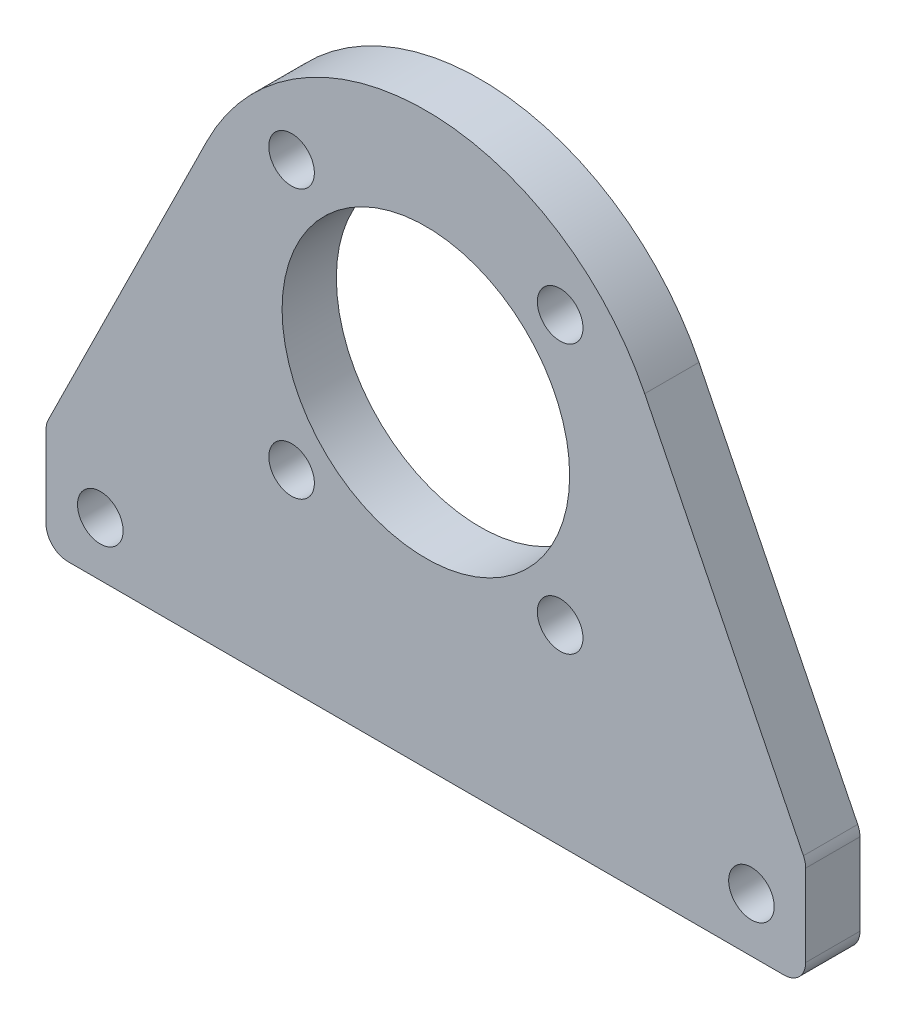
from build123d import *

# Parameters (mm, degrees)
SKETCH_1_R      = 2.1
SKETCH_1_R_2    = 13.25
EXTRUDE_1_DEPTH = 5
FILLET_1_R      = 2


with BuildPart() as part:
    # ｽｹｯﾁ1 → ﾎﾞｽ - 押し出し1 (new body)
    with BuildSketch(Plane.XY):
        with BuildLine():
            Line((-35, -110), (-20.166291803, -80.021489344))
            ThreePointArc((-20.166291803, -80.021489344), (0, -67.5), (20.166291803, -80.021489344))
            Line((20.166291803, -80.021489344), (35, -110))
            Line((35, -110), (35, -120))
            Line((35, -120), (-35, -120))
            Line((-35, -120), (-35, -110))
        make_face()
        with Locations((12.374368671, -77.625631329)):
            Circle(SKETCH_1_R, mode=Mode.SUBTRACT)
        with Locations((12.374368671, -102.374368671)):
            Circle(SKETCH_1_R, mode=Mode.SUBTRACT)
        with Locations((-12.374368671, -102.374368671)):
            Circle(SKETCH_1_R, mode=Mode.SUBTRACT)
        with Locations((-12.374368671, -77.625631329)):
            Circle(SKETCH_1_R, mode=Mode.SUBTRACT)
        with Locations((30, -115)):
            Circle(SKETCH_1_R, mode=Mode.SUBTRACT)
        with Locations((-30, -115)):
            Circle(SKETCH_1_R, mode=Mode.SUBTRACT)
        with Locations((0, -90)):
            Circle(SKETCH_1_R_2, mode=Mode.SUBTRACT)
    extrude(amount=EXTRUDE_1_DEPTH)

    # ﾌｨﾚｯﾄ1
    fillet_1_edges = [part.edges().sort_by_distance(p)[0] for p in [
        (35, -110, 2.5),
        (35, -120, 2.5),
        (-35, -110, 2.5),
        (-35, -120, 2.5),
    ]]
    fillet(fillet_1_edges, radius=FILLET_1_R)


solid = part.part
